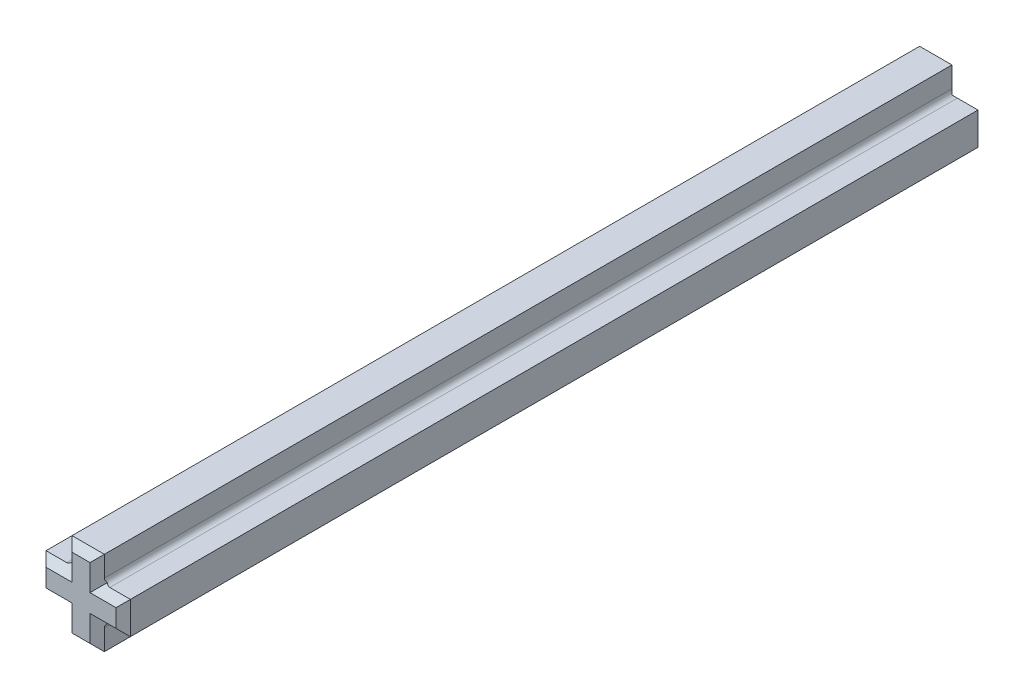
from build123d import *

# Parameters (mm, degrees)
BOSS_EXTRUDE1_DEPTH = 24
CHAMFER1_SIZE       = 0.4
FILLET1_R           = 0.3


with BuildPart() as part:
    # Sketch1 → Boss-Extrude1 (new, symmetric)
    with BuildSketch(Plane.XY):
        Polygon((0.9, -0.9), (0.9, -2.35), (-0.9, -2.35), (-0.9, -0.9), (-2.35, -0.9), (-2.35, 0.9), (-0.9, 0.9), (-0.9, 2.35), (0.9, 2.35), (0.9, 0.9), (2.35, 0.9), (2.35, -0.9), align=None)
    extrude(amount=BOSS_EXTRUDE1_DEPTH, both=True)

    # Chamfer1
    chamfer1_edges = [part.edges().sort_by_distance(p)[0] for p in [
        (2.35, 0, -24),
        (1.625, 0.9, -24),
        (0.9, 1.625, -24),
        (0, 2.35, -24),
        (-0.9, 1.625, -24),
        (-1.625, 0.9, -24),
        (-2.35, 0, -24),
        (-1.625, -0.9, -24),
        (-0.9, -1.625, -24),
        (0, -2.35, -24),
        (0.9, -1.625, -24),
        (1.625, -0.9, -24),
        (0.9, -1.625, 24),
        (0, -2.35, 24),
        (-0.9, -1.625, 24),
        (-1.625, -0.9, 24),
        (-2.35, 0, 24),
        (-1.625, 0.9, 24),
        (-0.9, 1.625, 24),
        (0, 2.35, 24),
        (0.9, 1.625, 24),
        (1.625, 0.9, 24),
        (2.35, 0, 24),
        (1.625, -0.9, 24),
    ]]
    chamfer(chamfer1_edges, length=CHAMFER1_SIZE)

    # Fillet1
    fillet1_edges = [part.edges().sort_by_distance(p)[0] for p in [
        (-0.9, -0.9, 0),
        (-0.9, 0.9, 0),
        (0.9, -0.9, 0),
        (0.9, 0.9, 0),
    ]]
    fillet(fillet1_edges, radius=FILLET1_R)


solid = part.part
